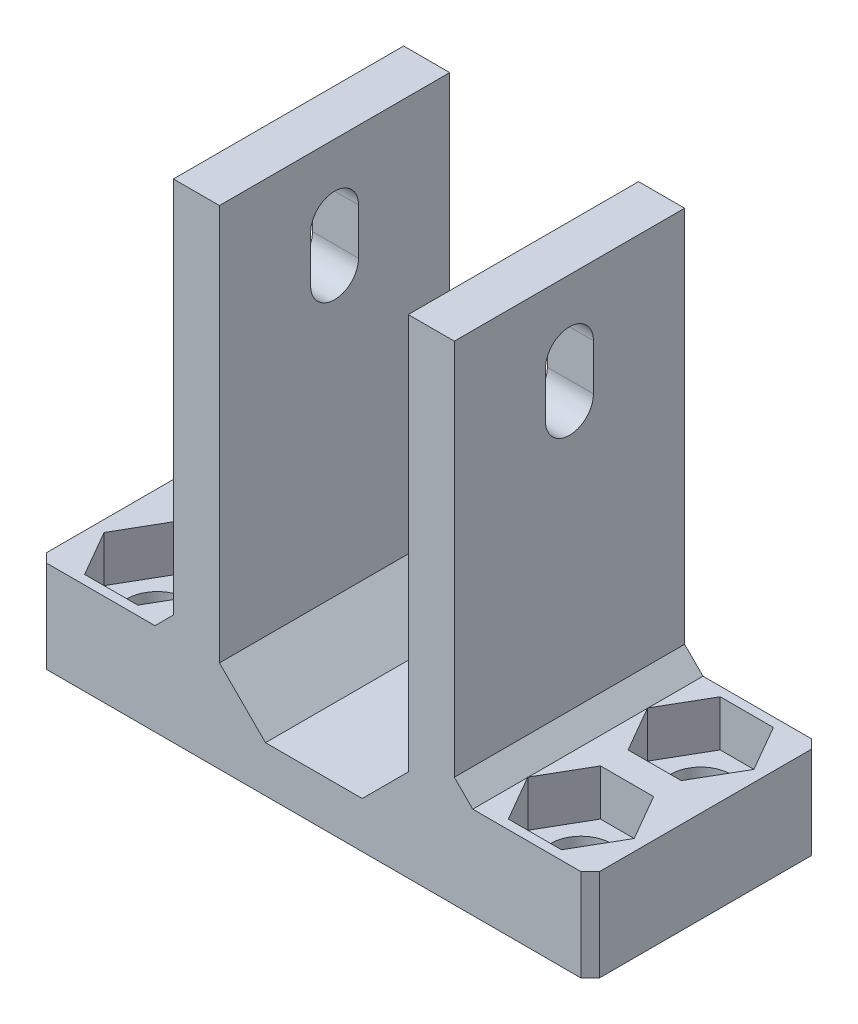
from build123d import *

# Parameters (mm, degrees)
SKETCH2_W           = 60
SKETCH2_H           = 25
SKETCH2_R           = 3.3
BOSS_EXTRUDE2_DEPTH = 5
SKETCH3_W           = 5
SKETCH3_H           = 48
BOSS_EXTRUDE3_DEPTH = 25
CUT_EXTRUDE1_REACH  = 72.801
SKETCH5_W           = 14.75
SKETCH5_H           = 25
BOSS_EXTRUDE4_DEPTH = 5
CHAMFER1_SIZE       = 2
CHAMFER2_SIZE       = 5
CHAMFER3_SIZE       = 1


with BuildPart() as part:
    # Sketch2 → Boss-Extrude2 (new body)
    with BuildSketch(Plane(origin=(0, 0, 0), x_dir=(1, 0, 0), z_dir=(0, 1, 0))):
        Rectangle(SKETCH2_W, SKETCH2_H)
        with Locations(Location((-23, 6.5, 0), (0, 0, 270))):
            Circle(SKETCH2_R, mode=Mode.SUBTRACT)
        with Locations(Location((23, 6.5, 0), (0, 0, 270))):
            Circle(SKETCH2_R, mode=Mode.SUBTRACT)
        with Locations(Location((-23, -6.5, 0), (0, 0, 270))):
            Circle(SKETCH2_R, mode=Mode.SUBTRACT)
        with Locations(Location((23, -6.5, 0), (0, 0, 270))):
            Circle(SKETCH2_R, mode=Mode.SUBTRACT)
    extrude(amount=BOSS_EXTRUDE2_DEPTH)

    # Sketch3 → Boss-Extrude3 (add)
    with BuildSketch(Plane.XY.offset(12.5)):
        with Locations((-12.75, 29)):
            Rectangle(SKETCH3_W, SKETCH3_H)
        with Locations((12.75, 29)):
            Rectangle(SKETCH3_W, SKETCH3_H)
    extrude(amount=-BOSS_EXTRUDE3_DEPTH)

    # Cut-Extrude1: up to this face of the body (flat: up to its plane)
    cut_extrude1_end = Plane(part.part.faces().sort_by_distance((-15.25, 29, 0))[0])
    # Sketch4 → Cut-Extrude1 (cut, up to the picked face)
    with BuildSketch(Plane(origin=(15.25, 0, 0), x_dir=(0, 0, -1), z_dir=(1, 0, 0)), mode=Mode.PRIVATE) as cut_extrude1_sk1:
        with BuildLine():
            Line((2.6, 45.5), (2.6, 40.5))
            ThreePointArc((2.6, 40.5), (0, 37.9), (-2.6, 40.5))
            Line((-2.6, 40.5), (-2.6, 45.5))
            ThreePointArc((-2.6, 45.5), (0, 48.1), (2.6, 45.5))
        make_face()
    cut_extrude1_tool1 = split(extrude(cut_extrude1_sk1.sketch, amount=-CUT_EXTRUDE1_REACH, mode=Mode.PRIVATE), bisect_by=cut_extrude1_end, keep=Keep.BOTH, mode=Mode.PRIVATE)
    add(cut_extrude1_tool1.solids().sort_by(Axis((15.25, 43, 0), (-1, 0, 0)))[0], mode=Mode.SUBTRACT)

    # Sketch5 → Boss-Extrude4 (add)
    # profile 1 of 2: a face of its own
    with BuildSketch(Plane(origin=(0, 5, 0), x_dir=(1, 0, 0), z_dir=(0, 1, 0))):
        with Locations((22.625, 0)):
            Rectangle(SKETCH5_W, SKETCH5_H)
        Polygon((28.773502692, 6.5), (25.886751346, 11.5), (20.113248654, 11.5), (17.226497308, 6.5), (20.113248654, 1.5), (25.886751346, 1.5), align=None, mode=Mode.SUBTRACT)
        Polygon((25.886751346, -1.5), (28.773502692, -6.5), (25.886751346, -11.5), (20.113248654, -11.5), (17.226497308, -6.5), (20.113248654, -1.5), align=None, mode=Mode.SUBTRACT)
    # profile 2 of 2: a face of its own
    with BuildSketch(Plane(origin=(0, 5, 0), x_dir=(1, 0, 0), z_dir=(0, 1, 0))):
        with Locations((-22.625, 0)):
            Rectangle(SKETCH5_W, SKETCH5_H)
        Polygon((-17.226497308, 6.5), (-20.113248654, 11.5), (-25.886751346, 11.5), (-28.773502692, 6.5), (-25.886751346, 1.5), (-20.113248654, 1.5), align=None, mode=Mode.SUBTRACT)
        Polygon((-20.113248654, -1.5), (-17.226497308, -6.5), (-20.113248654, -11.5), (-25.886751346, -11.5), (-28.773502692, -6.5), (-25.886751346, -1.5), align=None, mode=Mode.SUBTRACT)
    extrude(amount=BOSS_EXTRUDE4_DEPTH)

    # Chamfer1
    # the kernel refuses this chamfer: 2 mm, written as the material it adds along each edge
    with BuildSketch(Plane(origin=(15.25, 10, -12.5), x_dir=(0.9996219169112968, -0.02749587661058651, 0), z_dir=(0, 0, 1))) as chamfer1_piece_1_section:
        Polygon((CHAMFER1_SIZE * 0.999621916911, CHAMFER1_SIZE * 0.0274958766106), (-CHAMFER1_SIZE * 0.0274958766106, CHAMFER1_SIZE * 0.999621916911), (0, 0), align=None)
    chamfer1_piece_1 = extrude(amount=25, mode=Mode.PRIVATE)
    chamfer1_piece_1 = split(chamfer1_piece_1, bisect_by=Plane(origin=(15.178146825, 10.596401608, -10.047847108), z_dir=(0.8660254037844565, 0, -0.4999999999999692)), keep=Keep.TOP, mode=Mode.PRIVATE)
    chamfer1_piece_1 = split(chamfer1_piece_1, bisect_by=Plane(origin=(18.675487588, 10.596401608, -9.009724784), z_dir=(-0.8660254037844565, 0, -0.49999999999996914)), keep=Keep.TOP, mode=Mode.PRIVATE)
    add(chamfer1_piece_1)
    with BuildSketch(Plane(origin=(15.25, 10, -12.5), x_dir=(0.9996219169112968, -0.02749587661058651, 0), z_dir=(0, 0, 1))) as chamfer1_piece_2_section:
        Polygon((CHAMFER1_SIZE * 0.999621916911, CHAMFER1_SIZE * 0.0274958766106), (-CHAMFER1_SIZE * 0.0274958766106, CHAMFER1_SIZE * 0.999621916911), (0, 0), align=None)
    chamfer1_piece_2 = extrude(amount=25, mode=Mode.PRIVATE)
    chamfer1_piece_2 = split(chamfer1_piece_2, bisect_by=Plane(origin=(16.849076721, 10.762644927, -7.153711633), z_dir=(-0.8660254037844565, 0, 0.4999999999999692)), keep=Keep.TOP, mode=Mode.PRIVATE)
    chamfer1_piece_2 = split(chamfer1_piece_2, bisect_by=Plane(origin=(16.849076721, 10.762644927, -5.846288367), z_dir=(-0.8660254037844565, 0, -0.49999999999996914)), keep=Keep.TOP, mode=Mode.PRIVATE)
    add(chamfer1_piece_2)
    with BuildSketch(Plane(origin=(15.25, 10, -12.5), x_dir=(0.9996219169112968, -0.02749587661058651, 0), z_dir=(0, 0, 1))) as chamfer1_piece_3_section:
        Polygon((CHAMFER1_SIZE * 0.999621916911, CHAMFER1_SIZE * 0.0274958766106), (-CHAMFER1_SIZE * 0.0274958766106, CHAMFER1_SIZE * 0.999621916911), (0, 0), align=None)
    chamfer1_piece_3 = extrude(amount=25, mode=Mode.PRIVATE)
    chamfer1_piece_3 = split(chamfer1_piece_3, bisect_by=Plane(origin=(14.108732703, 10.603890332, 1.099873298), z_dir=(0.8660254037844565, 0, -0.49999999999996914)), keep=Keep.TOP, mode=Mode.PRIVATE)
    chamfer1_piece_3 = split(chamfer1_piece_3, bisect_by=Plane(origin=(19.737897828, 10.603890332, 2.150126702), z_dir=(-0.8660254037844565, 0, -0.4999999999999692)), keep=Keep.TOP, mode=Mode.PRIVATE)
    chamfer1_piece_3 = split(chamfer1_piece_3, bisect_by=Plane(origin=(19.737897828, 10.603890332, -2.150126702), z_dir=(-0.8660254037844565, 0, 0.4999999999999692)), keep=Keep.TOP, mode=Mode.PRIVATE)
    chamfer1_piece_3 = split(chamfer1_piece_3, bisect_by=Plane(origin=(14.108732703, 10.603890332, -1.099873298), z_dir=(0.8660254037844565, 0, 0.49999999999996914)), keep=Keep.TOP, mode=Mode.PRIVATE)
    add(chamfer1_piece_3)
    with BuildSketch(Plane(origin=(15.25, 10, -12.5), x_dir=(0.9996219169112968, -0.02749587661058651, 0), z_dir=(0, 0, 1))) as chamfer1_piece_4_section:
        Polygon((CHAMFER1_SIZE * 0.999621916911, CHAMFER1_SIZE * 0.0274958766106), (-CHAMFER1_SIZE * 0.0274958766106, CHAMFER1_SIZE * 0.999621916911), (0, 0), align=None)
    chamfer1_piece_4 = extrude(amount=25, mode=Mode.PRIVATE)
    chamfer1_piece_4 = split(chamfer1_piece_4, bisect_by=Plane(origin=(16.849076721, 10.762644927, 5.846288367), z_dir=(-0.8660254037844565, 0, 0.49999999999996914)), keep=Keep.TOP, mode=Mode.PRIVATE)
    chamfer1_piece_4 = split(chamfer1_piece_4, bisect_by=Plane(origin=(16.849076721, 10.762644927, 7.153711633), z_dir=(-0.8660254037844565, 0, -0.4999999999999692)), keep=Keep.TOP, mode=Mode.PRIVATE)
    add(chamfer1_piece_4)
    with BuildSketch(Plane(origin=(15.25, 10, -12.5), x_dir=(0.9996219169112968, -0.02749587661058651, 0), z_dir=(0, 0, 1))) as chamfer1_piece_5_section:
        Polygon((CHAMFER1_SIZE * 0.999621916911, CHAMFER1_SIZE * 0.0274958766106), (-CHAMFER1_SIZE * 0.0274958766106, CHAMFER1_SIZE * 0.999621916911), (0, 0), align=None)
    chamfer1_piece_5 = extrude(amount=25, mode=Mode.PRIVATE)
    chamfer1_piece_5 = split(chamfer1_piece_5, bisect_by=Plane(origin=(18.675487588, 10.596401608, 9.009724784), z_dir=(-0.8660254037844565, 0, 0.49999999999996914)), keep=Keep.TOP, mode=Mode.PRIVATE)
    chamfer1_piece_5 = split(chamfer1_piece_5, bisect_by=Plane(origin=(15.178146825, 10.596401608, 10.047847108), z_dir=(0.8660254037844565, 0, 0.4999999999999692)), keep=Keep.TOP, mode=Mode.PRIVATE)
    add(chamfer1_piece_5)
    with BuildSketch(Plane(origin=(-15.25, 10, 12.5), x_dir=(0.027495876610586487, 0.9996219169112968, 0), z_dir=(0, 0, -1))) as chamfer1_piece_6_section:
        Polygon((CHAMFER1_SIZE * 0.999621916911, -CHAMFER1_SIZE * 0.0274958766106), (-CHAMFER1_SIZE * 0.0274958766106, -CHAMFER1_SIZE * 0.999621916911), (0, 0), align=None)
    chamfer1_piece_6 = extrude(amount=25, mode=Mode.PRIVATE)
    chamfer1_piece_6 = split(chamfer1_piece_6, bisect_by=Plane(origin=(-15.178146825, 10.596401608, 10.047847108), z_dir=(-0.866025403784439, 0, 0.4999999999999995)), keep=Keep.TOP, mode=Mode.PRIVATE)
    chamfer1_piece_6 = split(chamfer1_piece_6, bisect_by=Plane(origin=(-18.675487588, 10.596401608, 9.009724784), z_dir=(0.8660254037844384, 0, 0.5000000000000004)), keep=Keep.TOP, mode=Mode.PRIVATE)
    add(chamfer1_piece_6)
    with BuildSketch(Plane(origin=(-15.25, 10, 12.5), x_dir=(0.027495876610586487, 0.9996219169112968, 0), z_dir=(0, 0, -1))) as chamfer1_piece_7_section:
        Polygon((CHAMFER1_SIZE * 0.999621916911, -CHAMFER1_SIZE * 0.0274958766106), (-CHAMFER1_SIZE * 0.0274958766106, -CHAMFER1_SIZE * 0.999621916911), (0, 0), align=None)
    chamfer1_piece_7 = extrude(amount=25, mode=Mode.PRIVATE)
    chamfer1_piece_7 = split(chamfer1_piece_7, bisect_by=Plane(origin=(-16.849076721, 10.762644927, 7.153711633), z_dir=(0.866025403784439, 0, -0.4999999999999995)), keep=Keep.TOP, mode=Mode.PRIVATE)
    chamfer1_piece_7 = split(chamfer1_piece_7, bisect_by=Plane(origin=(-16.849076721, 10.762644927, 5.846288367), z_dir=(0.8660254037844384, 0, 0.5000000000000004)), keep=Keep.TOP, mode=Mode.PRIVATE)
    add(chamfer1_piece_7)
    with BuildSketch(Plane(origin=(-15.25, 10, 12.5), x_dir=(0.027495876610586487, 0.9996219169112968, 0), z_dir=(0, 0, -1))) as chamfer1_piece_8_section:
        Polygon((CHAMFER1_SIZE * 0.999621916911, -CHAMFER1_SIZE * 0.0274958766106), (-CHAMFER1_SIZE * 0.0274958766106, -CHAMFER1_SIZE * 0.999621916911), (0, 0), align=None)
    chamfer1_piece_8 = extrude(amount=25, mode=Mode.PRIVATE)
    chamfer1_piece_8 = split(chamfer1_piece_8, bisect_by=Plane(origin=(-19.737897828, 10.603890332, 2.150126702), z_dir=(0.866025403784439, 0, -0.4999999999999995)), keep=Keep.TOP, mode=Mode.PRIVATE)
    chamfer1_piece_8 = split(chamfer1_piece_8, bisect_by=Plane(origin=(-14.108732703, 10.603890332, 1.099873298), z_dir=(-0.8660254037844384, 0, -0.5000000000000004)), keep=Keep.TOP, mode=Mode.PRIVATE)
    chamfer1_piece_8 = split(chamfer1_piece_8, bisect_by=Plane(origin=(-14.108732703, 10.603890332, -1.099873298), z_dir=(-0.8660254037844384, 0, 0.5000000000000006)), keep=Keep.TOP, mode=Mode.PRIVATE)
    chamfer1_piece_8 = split(chamfer1_piece_8, bisect_by=Plane(origin=(-19.737897828, 10.603890332, -2.150126702), z_dir=(0.866025403784439, 0, 0.4999999999999995)), keep=Keep.TOP, mode=Mode.PRIVATE)
    add(chamfer1_piece_8)
    with BuildSketch(Plane(origin=(-15.25, 10, 12.5), x_dir=(0.027495876610586487, 0.9996219169112968, 0), z_dir=(0, 0, -1))) as chamfer1_piece_9_section:
        Polygon((CHAMFER1_SIZE * 0.999621916911, -CHAMFER1_SIZE * 0.0274958766106), (-CHAMFER1_SIZE * 0.0274958766106, -CHAMFER1_SIZE * 0.999621916911), (0, 0), align=None)
    chamfer1_piece_9 = extrude(amount=25, mode=Mode.PRIVATE)
    chamfer1_piece_9 = split(chamfer1_piece_9, bisect_by=Plane(origin=(-16.849076721, 10.762644927, -5.846288367), z_dir=(0.8660254037844384, 0, -0.5000000000000006)), keep=Keep.TOP, mode=Mode.PRIVATE)
    chamfer1_piece_9 = split(chamfer1_piece_9, bisect_by=Plane(origin=(-16.849076721, 10.762644927, -7.153711633), z_dir=(0.866025403784439, 0, 0.4999999999999995)), keep=Keep.TOP, mode=Mode.PRIVATE)
    add(chamfer1_piece_9)
    with BuildSketch(Plane(origin=(-15.25, 10, 12.5), x_dir=(0.027495876610586487, 0.9996219169112968, 0), z_dir=(0, 0, -1))) as chamfer1_piece_10_section:
        Polygon((CHAMFER1_SIZE * 0.999621916911, -CHAMFER1_SIZE * 0.0274958766106), (-CHAMFER1_SIZE * 0.0274958766106, -CHAMFER1_SIZE * 0.999621916911), (0, 0), align=None)
    chamfer1_piece_10 = extrude(amount=25, mode=Mode.PRIVATE)
    chamfer1_piece_10 = split(chamfer1_piece_10, bisect_by=Plane(origin=(-18.675487588, 10.596401608, -9.009724784), z_dir=(0.8660254037844384, 0, -0.5000000000000006)), keep=Keep.TOP, mode=Mode.PRIVATE)
    chamfer1_piece_10 = split(chamfer1_piece_10, bisect_by=Plane(origin=(-15.178146825, 10.596401608, -10.047847108), z_dir=(-0.866025403784439, 0, -0.4999999999999995)), keep=Keep.TOP, mode=Mode.PRIVATE)
    add(chamfer1_piece_10)

    # Chamfer2
    chamfer2_edges = [part.edges().sort_by_distance(p)[0] for p in [
        (-10.25, 5, 0),
        (10.25, 5, 0),
    ]]
    chamfer(chamfer2_edges, length=CHAMFER2_SIZE)

    # Chamfer3
    chamfer3_edges = [part.edges().sort_by_distance(p)[0] for p in [
        (30, 5, 12.5),
        (-30, 5, 12.5),
        (-30, 5, -12.5),
        (30, 5, -12.5),
    ]]
    chamfer(chamfer3_edges, length=CHAMFER3_SIZE)


solid = part.part
